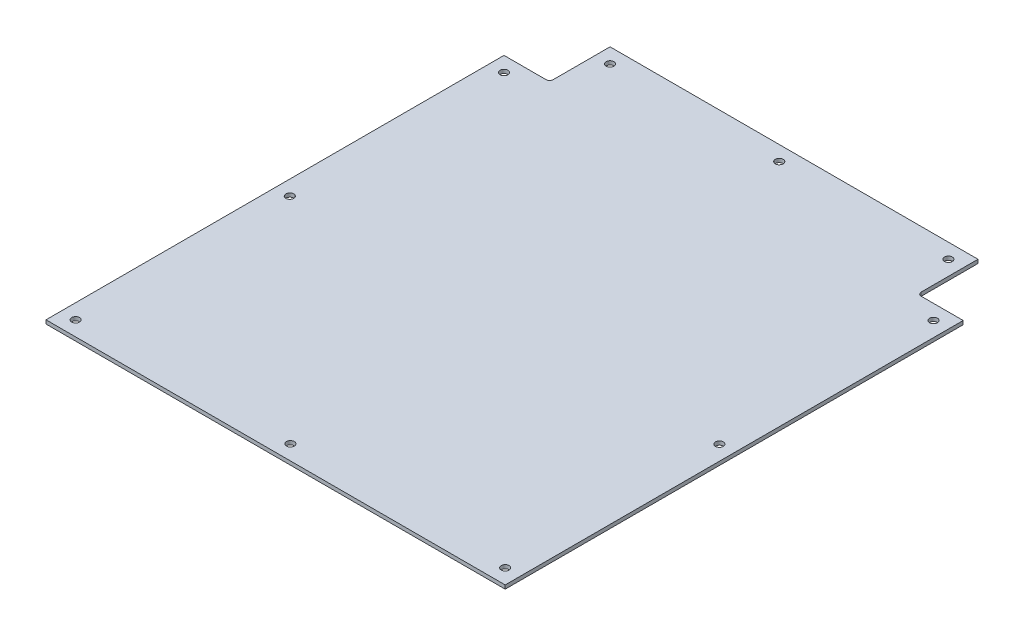
from build123d import *

# Parameters (mm, degrees)
SKETCH1_W                   = 393.7
SKETCH1_H                   = 444.5
BOSS_EXTRUDE1_DEPTH         = 3.175
CUT_EXTRUDE1_DEPTH          = 10
F_1_4_CLEARANCE_HOLE1_D     = 6.7564
F_1_4_CLEARANCE_HOLE1_DEPTH = 18.75
F_1_4_CLEARANCE_HOLE1_TIP   = 2.029827343


with BuildPart() as part:
    # Sketch1 → Boss-Extrude1 (new body)
    with BuildSketch(Plane(origin=(0, 0, 0), x_dir=(1, 0, 0), z_dir=(0, 1, 0))):
        Rectangle(SKETCH1_W, SKETCH1_H)
    extrude(amount=BOSS_EXTRUDE1_DEPTH)

    # Sketch2 → Cut-Extrude1 (cut)
    with BuildSketch(Plane(origin=(0, 3.175, 0), x_dir=(1, 0, 0), z_dir=(0, 1, 0))):
        with BuildLine():
            Line((-196.85, 222.25), (-157.734, 222.25))
            Line((-157.734, 222.25), (-157.734, 173.609))
            ThreePointArc((-157.734, 173.609), (-158.66393597, 171.36393597), (-160.909, 170.434))
            Line((-160.909, 170.434), (-196.85, 170.434))
            Line((-196.85, 170.434), (-196.85, 222.25))
        make_face()
        with BuildLine():
            Line((196.85, 222.25), (157.734, 222.25))
            Line((157.734, 222.25), (157.734, 173.609))
            ThreePointArc((157.734, 173.609), (158.66393597, 171.36393597), (160.909, 170.434))
            Line((160.909, 170.434), (196.85, 170.434))
            Line((196.85, 170.434), (196.85, 222.25))
        make_face()
    extrude(amount=-CUT_EXTRUDE1_DEPTH, mode=Mode.SUBTRACT)

    # 1/4 Clearance Hole1
    with Locations(Plane(origin=(0, 3.175, 0), x_dir=(1, 0, 0), z_dir=(0, 1, 0))):
        with Locations((184.15, -209.55), (-184.15, -209.55), (-184.15, 157.734), (-145.034, 209.55), (145.034, 209.55), (184.15, 157.734), (184.15, -25.908), (0, -209.55), (-184.15, -25.908), (0, 209.55)):
            Hole(F_1_4_CLEARANCE_HOLE1_D / 2, depth=F_1_4_CLEARANCE_HOLE1_DEPTH)
            with Locations((0, 0, -(F_1_4_CLEARANCE_HOLE1_DEPTH + F_1_4_CLEARANCE_HOLE1_TIP / 2))):  # 118° drill point
                Cone(0, F_1_4_CLEARANCE_HOLE1_D / 2, F_1_4_CLEARANCE_HOLE1_TIP, mode=Mode.SUBTRACT)


solid = part.part
